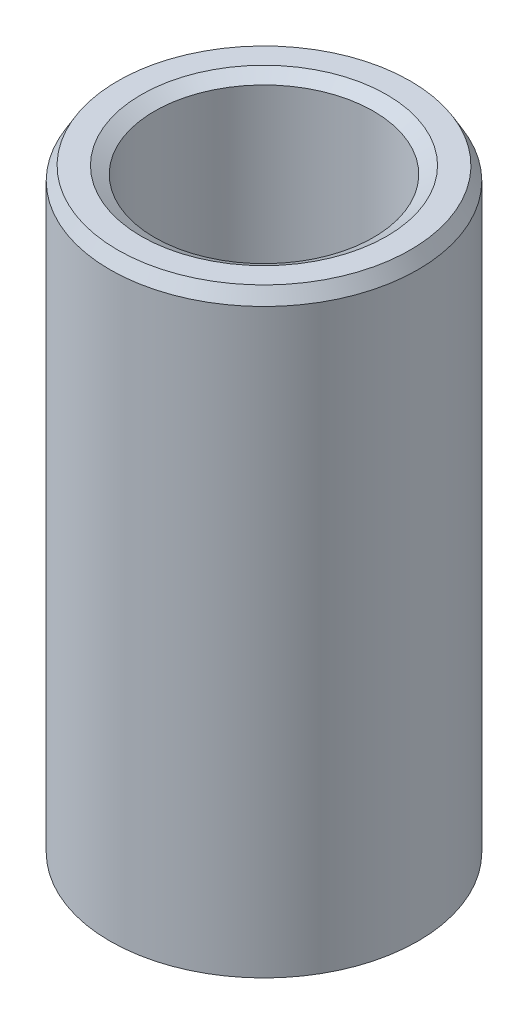
from build123d import *
from OCP.BRepFilletAPI import BRepFilletAPI_MakeChamfer

# Parameters (mm, degrees)
SKETCH1_R           = 15
BOSS_EXTRUDE1_DEPTH = 58.675123479
SKETCH2_R           = 10.661233695
CUT_EXTRUDE1_DEPTH  = 63.392067727
CHAMFER1_SIZE       = 1.292401839
CHAMFER1_SIZE2      = 0.74616855


with BuildPart() as part:
    # Sketch1 → Boss-Extrude1 (new body)
    with BuildSketch(Plane(origin=(0, 0, 0), x_dir=(1, 0, 0), z_dir=(0, 1, 0))):
        Circle(SKETCH1_R)
    extrude(amount=BOSS_EXTRUDE1_DEPTH)

    # Sketch2 → Cut-Extrude1 (cut, through all)
    with BuildSketch(Plane(origin=(0, 0, 0), x_dir=(1, 0, 0), z_dir=(0, 1, 0))):
        Circle(SKETCH2_R)
    extrude(amount=CUT_EXTRUDE1_DEPTH, mode=Mode.SUBTRACT)

    # Chamfer1: one chamfer whose edges measure the first distance from different faces: ONE call of the kernel's chamfer builder (chamfer() names one face for all edges)
    chamfer1_edges_1 = [part.edges().sort_by_distance(p)[0] for p in [
        (-10.661233695, 58.675123479, 0),
    ]]
    chamfer1_side_1 = [part.faces().sort_by_distance(p)[0] for p in [
        (-14.575735931, 58.675123479, 0),
    ]]
    chamfer1_edges_2 = [part.edges().sort_by_distance(p)[0] for p in [
        (-10.661233695, 0, 0),
    ]]
    chamfer1_side_2 = [part.faces().sort_by_distance(p)[0] for p in [
        (-10.661233695, 29.337561739, 0),
    ]]
    chamfer1_edges_3 = [part.edges().sort_by_distance(p)[0] for p in [
        (-15, 0, 0),
    ]]
    chamfer1_side_3 = [part.faces().sort_by_distance(p)[0] for p in [
        (-14.575735931, 0, 0),
    ]]
    chamfer1_edges_4 = [part.edges().sort_by_distance(p)[0] for p in [
        (-15, 58.675123479, 0),
    ]]
    chamfer1_side_4 = [part.faces().sort_by_distance(p)[0] for p in [
        (-15, 29.337561739, 0),
    ]]
    chamfer1 = BRepFilletAPI_MakeChamfer(part.part.solid().wrapped)
    for e in chamfer1_edges_1:
        chamfer1.Add(CHAMFER1_SIZE, CHAMFER1_SIZE2, e.wrapped, chamfer1_side_1[0].wrapped)  # the first distance lies on this face
    for e in chamfer1_edges_2:
        chamfer1.Add(CHAMFER1_SIZE, CHAMFER1_SIZE2, e.wrapped, chamfer1_side_2[0].wrapped)  # the first distance lies on this face
    for e in chamfer1_edges_3:
        chamfer1.Add(CHAMFER1_SIZE, CHAMFER1_SIZE2, e.wrapped, chamfer1_side_3[0].wrapped)  # the first distance lies on this face
    for e in chamfer1_edges_4:
        chamfer1.Add(CHAMFER1_SIZE, CHAMFER1_SIZE2, e.wrapped, chamfer1_side_4[0].wrapped)  # the first distance lies on this face
    add(Compound.cast(chamfer1.Shape()), mode=Mode.REPLACE)


solid = part.part
